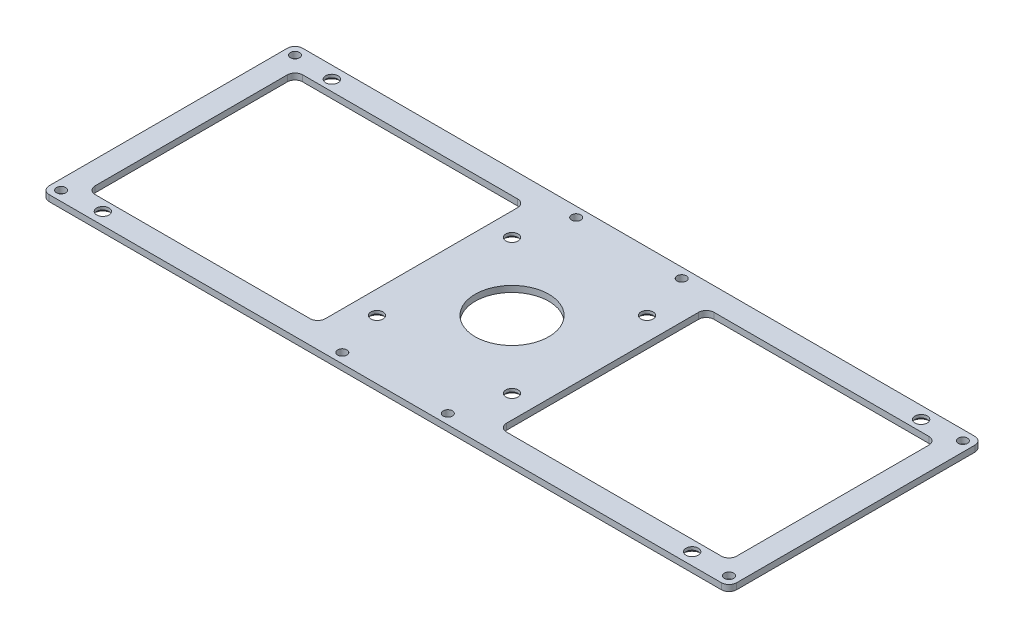
from build123d import *

# Parameters (mm, degrees)
SKETCH1_W             = 200
SKETCH1_H             = 82.6
BASE_FLANGE1_DEPTH    = 2
SKETCH6_R             = 2
CUT_EXTRUDE1_DEPTH    = 148.587569056
SKETCH7_R             = 12
CUT_EXTRUDE2_DEPTH    = 148.587569056
SKETCH8_R             = 2
SKETCH8_W             = 63
SKETCH8_H             = 67.6
CUT_EXTRUDE3_DEPTH    = 148.587569056
CHAMFER1_SIZE         = 1
SKETCH10_W            = 82.6
SKETCH10_H            = 2
BOSS_EXTRUDE1_DEPTH   = 12
SKETCH11_W            = 82.6
SKETCH11_H            = 2
BOSS_EXTRUDE2_DEPTH   = 12
SKETCH12_W            = 12
SKETCH12_H            = 67.6
CUT_EXTRUDE4_DEPTH    = 159.943577694
FILLET2_R             = 2.5
F_3_0MM_DOWEL_HOLE1_D = 3


# Sheet-metal steps are written as plain solids
with BuildPart() as part:
    # Sketch1 → Base-Flange1 (new body)
    with BuildSketch(Plane(origin=(0, 0, 0), x_dir=(1, 0, 0), z_dir=(0, 1, 0))):
        with Locations((39.040431267, 8.155525606)):
            Rectangle(SKETCH1_W, SKETCH1_H)
    extrude(amount=-BASE_FLANGE1_DEPTH)

    # Sketch6 → Cut-Extrude1 (cut, through all)
    with BuildSketch(Plane(origin=(0, 0, 0), x_dir=(1, 0, 0), z_dir=(0, 1, 0))):
        with Locations(Location((-56.959568733, 45.455525606, 0), (0, 0, 270))):
            Circle(SKETCH6_R)
        with Locations(Location((-56.959568733, -29.144474394, 0), (0, 0, 270))):
            Circle(SKETCH6_R)
        with Locations(Location((135.040431267, -29.144474394, 0), (0, 0, 270))):
            Circle(SKETCH6_R)
        with Locations(Location((135.040431267, 45.455525606, 0), (0, 0, 270))):
            Circle(SKETCH6_R)
    extrude(amount=-CUT_EXTRUDE1_DEPTH, mode=Mode.SUBTRACT)

    # Sketch7 → Cut-Extrude2 (cut, through all)
    with BuildSketch(Plane(origin=(0, 0, 0), x_dir=(1, 0, 0), z_dir=(0, 1, 0))):
        with Locations(Location((39.040431267, 8.155525606, 0), (0, 0, 270))):
            Circle(SKETCH7_R)
    extrude(amount=-CUT_EXTRUDE2_DEPTH, mode=Mode.SUBTRACT)

    # Sketch8 → Cut-Extrude3 (cut, through all)
    with BuildSketch(Plane(origin=(0, 0, 0), x_dir=(1, 0, 0), z_dir=(0, 1, 0))):
        with Locations(Location((17.040431267, 30.155525606, 0), (0, 0, 270))):
            Circle(SKETCH8_R)
        with Locations(Location((61.040431267, 30.155525606, 0), (0, 0, 270))):
            Circle(SKETCH8_R)
        with Locations(Location((61.040431267, -13.844474394, 0), (0, 0, 270))):
            Circle(SKETCH8_R)
        with Locations(Location((17.040431267, -13.844474394, 0), (0, 0, 270))):
            Circle(SKETCH8_R)
        with Locations((-21.959568733, 8.155525606)):
            Rectangle(SKETCH8_W, SKETCH8_H)
        with Locations((100.040431267, 8.155525606)):
            Rectangle(SKETCH8_W, SKETCH8_H)
    extrude(amount=-CUT_EXTRUDE3_DEPTH, mode=Mode.SUBTRACT)

    # Chamfer1
    chamfer1_edges = [part.edges().sort_by_distance(p)[0] for p in [
        (135.040431267, -2, -47.455525606),
        (135.040431267, -2, 27.144474394),
        (-56.959568733, -2, 27.144474394),
        (-56.959568733, -2, -47.455525606),
        (17.040431267, -2, 11.844474394),
        (61.040431267, -2, 11.844474394),
        (61.040431267, -2, -32.155525606),
        (17.040431267, -2, -32.155525606),
    ]]
    chamfer(chamfer1_edges, length=CHAMFER1_SIZE)

    # Sketch10 → Boss-Extrude1 (add)
    with BuildSketch(Plane.ZY.offset(60.959568733)):
        with Locations((-8.155525606, -1)):
            Rectangle(SKETCH10_W, SKETCH10_H)
    extrude(amount=BOSS_EXTRUDE1_DEPTH)

    # Sketch11 → Boss-Extrude2 (add)
    with BuildSketch(Plane(origin=(139.040431267, 0, 0), x_dir=(0, 0, -1), z_dir=(1, 0, 0))):
        with Locations((8.155525606, -1)):
            Rectangle(SKETCH11_W, SKETCH11_H)
    extrude(amount=BOSS_EXTRUDE2_DEPTH)

    # Sketch12 → Cut-Extrude4 (cut, through all)
    with BuildSketch(Plane(origin=(0, 0, 0), x_dir=(1, 0, 0), z_dir=(0, 1, 0))):
        with Locations((-59.459568733, 8.155525606)):
            Rectangle(SKETCH12_W, SKETCH12_H)
        with Locations((137.540431267, 8.155525606)):
            Rectangle(SKETCH12_W, SKETCH12_H)
    extrude(amount=-CUT_EXTRUDE4_DEPTH, mode=Mode.SUBTRACT)

    # Fillet2
    fillet2_edges = [part.edges().sort_by_distance(p)[0] for p in [
        (-72.959568733, -1, 33.144474394),
        (-72.959568733, -1, -49.455525606),
        (151.040431267, -1, 33.144474394),
        (151.040431267, -1, -49.455525606),
        (-65.459568733, -1, 25.644474394),
        (-65.459568733, -1, -41.955525606),
        (143.540431267, -1, -41.955525606),
        (143.540431267, -1, 25.644474394),
        (68.540431267, -1, 25.644474394),
        (68.540431267, -1, -41.955525606),
        (9.540431267, -1, -41.955525606),
        (9.540431267, -1, 25.644474394),
    ]]
    fillet(fillet2_edges, radius=FILLET2_R)

    # Ø3.0mm Dowel Hole1 (through all)
    with Locations(Plane(origin=(0, -2, 0), x_dir=(-1, 0, 0), z_dir=(0, -1, 0))):
        with Locations((69.7595751, -29.944469865), (69.759567513, 46.255524386), (-21.840432167, 46.255524386), (-21.84042458, -29.944469865), (-56.240437954, 46.255521078), (-56.240430367, -29.944473174), (-147.840430047, -29.944473174), (-147.840437634, 46.255521078)):
            Hole(F_3_0MM_DOWEL_HOLE1_D / 2)


solid = part.part
